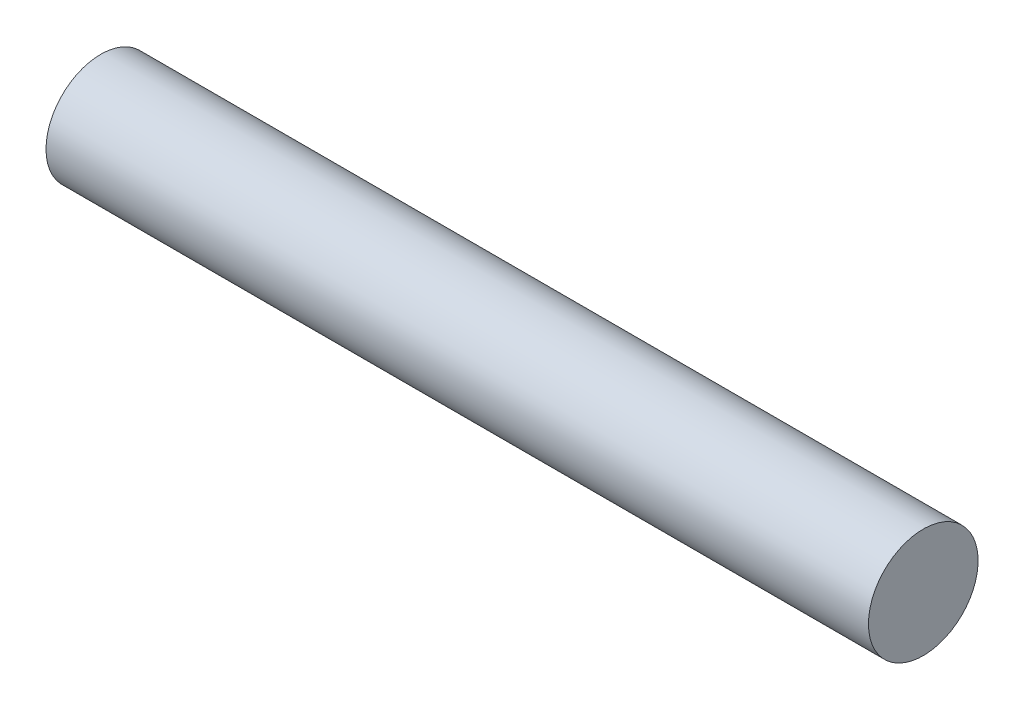
from build123d import *

# Parameters (mm, degrees)
SKETCH1_W = 114.3
SKETCH1_H = 7.62


with BuildPart() as part:
    # Sketch1 → Revolve10 (revolve)
    with BuildSketch(Plane.XY):
        with Locations((0, 3.81)):
            Rectangle(SKETCH1_W, SKETCH1_H)
    revolve(axis=Axis((-27.068427673, 0, 0), (1, 0, 0)))


solid = part.part
